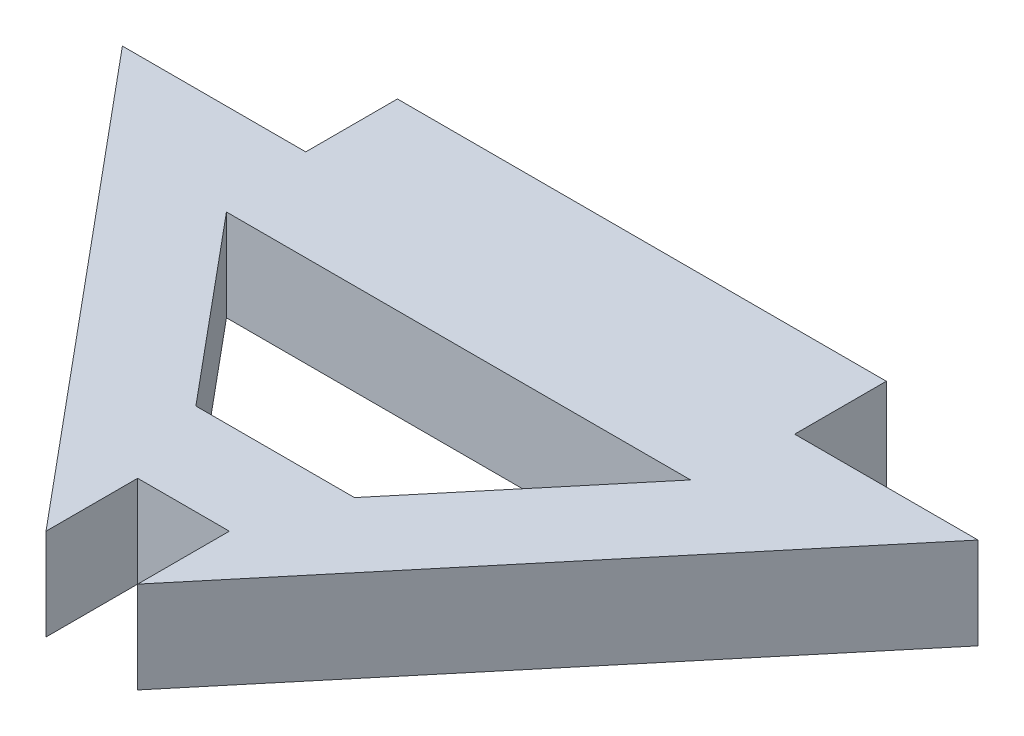
from build123d import *

# Parameters (mm, degrees)
BOSS_EXTRUDE1_DEPTH = 3


with BuildPart() as part:
    # Sketch1 → Boss-Extrude1 (new body)
    with BuildSketch(Plane(origin=(0, 0, 0), x_dir=(1, 0, 0), z_dir=(0, 1, 0))):
        Polygon((22.079481216, 3.028725772), (16.079481216, 3.028725772), (16.079481216, 6.028725772), (0.079481216, 6.028725772), (0.079481216, 3.028725772), (-5.920518784, 3.028725772), (6.579481216, -11.971274228), (6.579481216, -8.971274228), (9.579481216, -8.971274228), (9.579481216, -11.971274228), align=None)
        Polygon((15.674356378, 0.028725772), (0.484606054, 0.028725772), (5.484606054, -5.971274228), (10.674356378, -5.971274228), align=None, mode=Mode.SUBTRACT)
    extrude(amount=BOSS_EXTRUDE1_DEPTH)


solid = part.part
